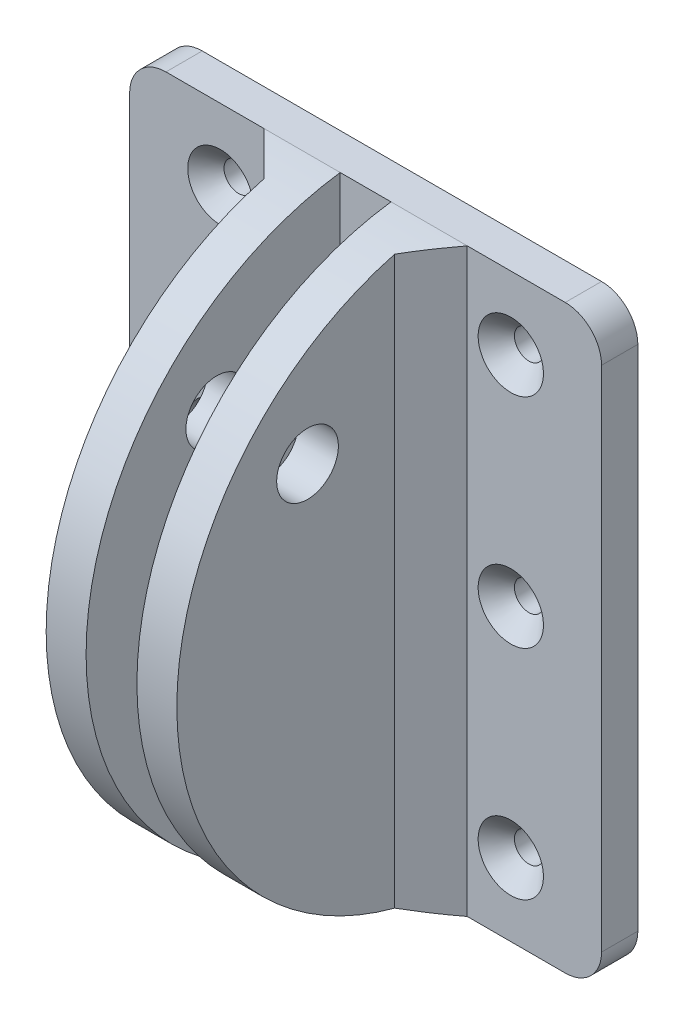
from build123d import *

# Parameters (mm, degrees)
ESQUISSE1_W                  = 65
ESQUISSE1_H                  = 80
BOSS_EXTRU_1_DEPTH           = 5
ENL_V_MAT_EXTRU_1_DEPTH      = 104.198837203
ENL_V_MAT_EXTRU_1_DEPTH_BACK = 104.198837203
ESQUISSE2_R                  = 2
ESQUISSE3_W                  = 18
ESQUISSE3_H                  = 80
BOSS_EXTRU_2_DEPTH           = 35
ENL_V_MAT_EXTRU_2_DEPTH      = 99.601470577
ENL_V_MAT_EXTRU_2_DEPTH_BACK = 99.601470577
ENL_V_MAT_EXTRU_3_DEPTH      = 99.601470577
ENL_V_MAT_EXTRU_3_DEPTH_BACK = 99.601470577
ESQUISSE5_R                  = 4.25
ESQUISSE6_W                  = 7
ESQUISSE6_H                  = 80
ENL_V_MAT_EXTRU_4_DEPTH      = 109.857705285
CHANFREIN1_SIZE              = 5
CHANFREIN2_SIZE              = 2.5
CONG_1_R                     = 5


with BuildPart() as part:
    # Esquisse1 → Boss.-Extru.1 (new body)
    with BuildSketch(Plane.XY):
        with Locations((32.5, 40)):
            Rectangle(ESQUISSE1_W, ESQUISSE1_H)
    extrude(amount=BOSS_EXTRU_1_DEPTH)

    # Esquisse2 → Enlèv. mat.-Extru.1 (cut, two sides: drawn at the far end of the back side and taken through both)
    with BuildSketch(Plane.XY.offset(5).offset(-ENL_V_MAT_EXTRU_1_DEPTH_BACK)):
        with Locations((12.5, 70)):
            Circle(ESQUISSE2_R)
        with Locations(Location((12.5, 10, 0), (0, 0, 180))):
            Circle(ESQUISSE2_R)
        with Locations((12.5, 40)):
            Circle(ESQUISSE2_R)
        with Locations(Location((52.5, 40, 0), (0, 0, 180))):
            Circle(ESQUISSE2_R)
        with Locations((52.5, 10)):
            Circle(ESQUISSE2_R)
        with Locations(Location((52.5, 70, 0), (0, 0, 180))):
            Circle(ESQUISSE2_R)
    extrude(amount=ENL_V_MAT_EXTRU_1_DEPTH + ENL_V_MAT_EXTRU_1_DEPTH_BACK, mode=Mode.SUBTRACT)

    # Esquisse3 → Boss.-Extru.2 (add)
    with BuildSketch(Plane.XY.offset(5)):
        with Locations((32.5, 40)):
            Rectangle(ESQUISSE3_W, ESQUISSE3_H)
    extrude(amount=BOSS_EXTRU_2_DEPTH)

    # Esquisse4 → Enlèv. mat.-Extru.2 (cut, two sides: drawn at the far end of the back side and taken through both)
    with BuildSketch(Plane.ZY.offset(-23.5).offset(-ENL_V_MAT_EXTRU_2_DEPTH_BACK)):
        with BuildLine():
            Line((5, 80), (41, 80))
            Line((41, 80), (41, 0))
            Line((41, 0), (5, 0))
            ThreePointArc((5, 0), (40, 40), (5, 80))
        make_face()
    extrude(amount=ENL_V_MAT_EXTRU_2_DEPTH + ENL_V_MAT_EXTRU_2_DEPTH_BACK, mode=Mode.SUBTRACT)

    # Esquisse5 → Enlèv. mat.-Extru.3 (cut, two sides: drawn at the far end of the back side and taken through both)
    with BuildSketch(Plane.ZY.offset(-23.5).offset(-ENL_V_MAT_EXTRU_3_DEPTH_BACK)):
        with Locations(Location((22, 60, 0), (0, 0, 270))):
            Circle(ESQUISSE5_R)
    extrude(amount=ENL_V_MAT_EXTRU_3_DEPTH + ENL_V_MAT_EXTRU_3_DEPTH_BACK, mode=Mode.SUBTRACT)

    # Esquisse6 → Enlèv. mat.-Extru.4 (cut, through all)
    with BuildSketch(Plane.XY.offset(5)):
        with Locations((32.5, 40)):
            Rectangle(ESQUISSE6_W, ESQUISSE6_H)
    extrude(amount=ENL_V_MAT_EXTRU_4_DEPTH, mode=Mode.SUBTRACT)

    # Chanfrein1
    # the kernel refuses this chamfer: 5 mm, written as the material it adds along each edge
    with BuildSketch(Plane(origin=(41.5, 0, 5), x_dir=(0.9996219169112968, 0, -0.027495876610586317), z_dir=(0, 1, 0))) as chanfrein1_piece_1_section:
        Polygon((CHANFREIN1_SIZE * 0.999621916911, -CHANFREIN1_SIZE * 0.0274958766106), (-CHANFREIN1_SIZE * 0.0274958766106, -CHANFREIN1_SIZE * 0.999621916911), (0, 0), align=None)
    chanfrein1_piece_1 = extrude(amount=80, mode=Mode.PRIVATE)
    chanfrein1_piece_1 = chanfrein1_piece_1 & Plane(origin=(43.152902744, 40, -0.357142857), x_dir=(0, -0.9911504424778762, 0.13274336283185842), z_dir=(1, 0, 0)) * Cylinder(40.357142857, 180, mode=Mode.PRIVATE)
    add(chanfrein1_piece_1)
    with BuildSketch(Plane(origin=(23.5, 80, 5), x_dir=(-0.9996219169112968, 0, -0.027495876610586317), z_dir=(0, -1, 0))) as chanfrein1_piece_2_section:
        Polygon((CHANFREIN1_SIZE * 0.999621916911, -CHANFREIN1_SIZE * 0.0274958766106), (-CHANFREIN1_SIZE * 0.0274958766106, -CHANFREIN1_SIZE * 0.999621916911), (0, 0), align=None)
    chanfrein1_piece_2 = extrude(amount=80, mode=Mode.PRIVATE)
    chanfrein1_piece_2 = chanfrein1_piece_2 & Plane(origin=(21.847097256, 40, -0.357142857), x_dir=(0, -0.9911504424778762, 0.13274336283185842), z_dir=(1, 0, 0)) * Cylinder(40.357142857, 180, mode=Mode.PRIVATE)
    add(chanfrein1_piece_2)

    # Chanfrein2
    chanfrein2_edges = [part.edges().sort_by_distance(p)[0] for p in [
        (10.5, 70, 5),
        (14.5, 10, 5),
        (10.5, 40, 5),
        (54.5, 70, 5),
        (50.5, 10, 5),
        (54.5, 40, 5),
    ]]
    chamfer(chanfrein2_edges, length=CHANFREIN2_SIZE)

    # Congé1
    cong_1_edges = [part.edges().sort_by_distance(p)[0] for p in [
        (0, 80, 2.5),
        (65, 80, 2.5),
        (65, 0, 2.5),
        (0, 0, 2.5),
    ]]
    fillet(cong_1_edges, radius=CONG_1_R)


solid = part.part
